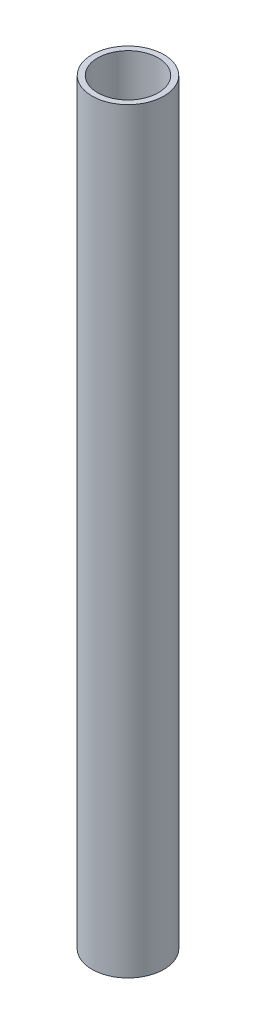
from build123d import *

# Parameters (mm, degrees)
SKETCH1_R           = 9.5
SKETCH1_R_2         = 8
BOSS_EXTRUDE1_DEPTH = 200


with BuildPart() as part:
    # Sketch1 → Boss-Extrude1 (new body)
    with BuildSketch(Plane(origin=(0, 0, 0), x_dir=(1, 0, 0), z_dir=(0, 1, 0))):
        Circle(SKETCH1_R)
        Circle(SKETCH1_R_2, mode=Mode.SUBTRACT)
    extrude(amount=BOSS_EXTRUDE1_DEPTH)


solid = part.part
